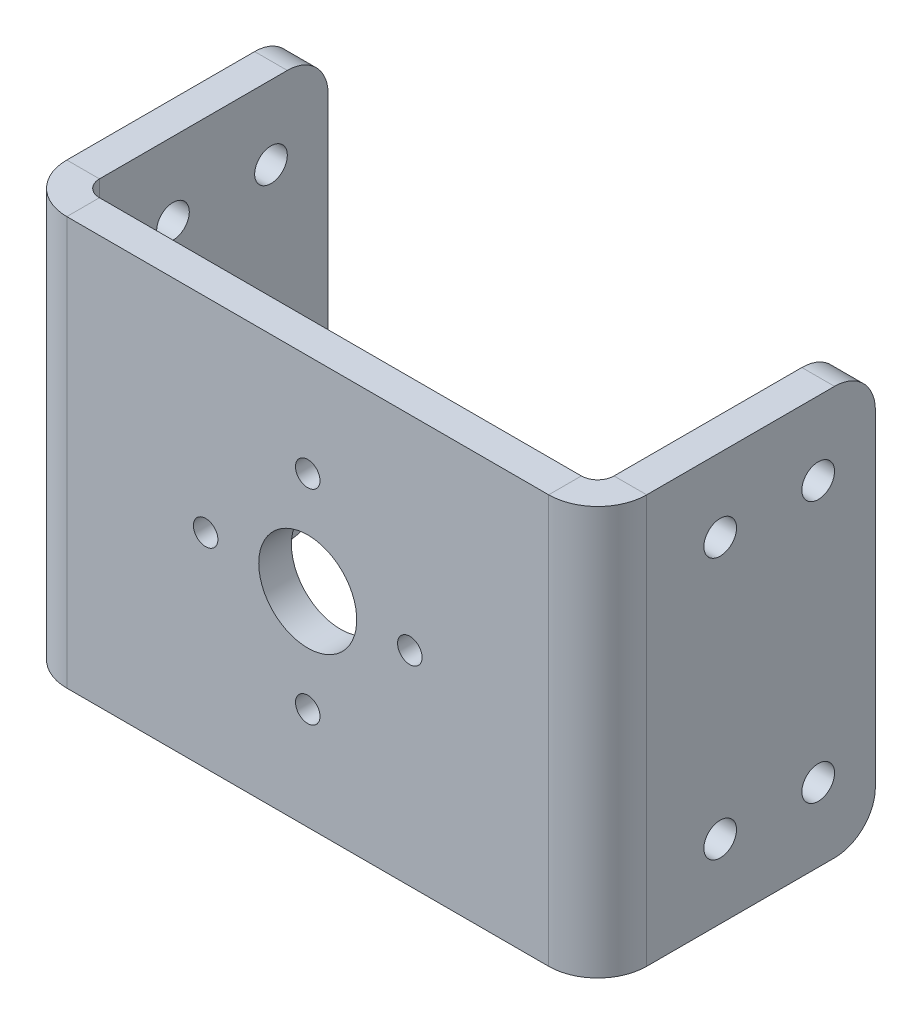
from build123d import *

# Parameters (mm, degrees)
SM_BASE_FLANGE_3_DEPTH = 50
SKETCH_14_R            = 6
SKETCH_14_R_2          = 1.5
CUT_EXTRUDE_1_DEPTH    = 69.26602376
SKETCH_15_R            = 2
CUT_EXTRUDE_2_DEPTH    = 94.257707456
FILLET_1_R             = 5


# Sheet-metal steps are written as plain solids
with BuildPart() as part:
    # 草图1 → 基体-法兰3 (new body)
    with BuildSketch(Plane(origin=(0, 0, 0), x_dir=(1, 0, 0), z_dir=(0, 1, 0))):
        with BuildLine():
            Line((-35.5, 34), (-35.5, 6))
            ThreePointArc((-35.5, 6), (-33.742640687, 1.757359313), (-29.5, 0))
            Line((-29.5, 0), (29.5, 0))
            ThreePointArc((29.5, 0), (33.742640687, 1.757359313), (35.5, 6))
            Line((35.5, 6), (35.5, 34))
            Line((35.5, 34), (31.5, 34))
            Line((31.5, 34), (31.5, 6))
            ThreePointArc((31.5, 6), (30.914213562, 4.585786438), (29.5, 4))
            Line((29.5, 4), (-29.5, 4))
            ThreePointArc((-29.5, 4), (-30.914213562, 4.585786438), (-31.5, 6))
            Line((-31.5, 6), (-31.5, 34))
            Line((-31.5, 34), (-35.5, 34))
        make_face()
    extrude(amount=SM_BASE_FLANGE_3_DEPTH)

    # 草图14 → 切除-拉伸1 (cut, through all)
    with BuildSketch(Plane(origin=(0, 0, -4), x_dir=(-1, 0, 0), z_dir=(0, 0, -1))):
        with Locations((0, 25)):
            Circle(SKETCH_14_R)
        with Locations((0, 37.5)):
            Circle(SKETCH_14_R_2)
        with Locations((12.5, 25)):
            Circle(SKETCH_14_R_2)
        with Locations((0, 12.5)):
            Circle(SKETCH_14_R_2)
        with Locations((-12.5, 25)):
            Circle(SKETCH_14_R_2)
    extrude(amount=-CUT_EXTRUDE_1_DEPTH, mode=Mode.SUBTRACT)

    # 草图15 → 切除-拉伸2 (cut, through all)
    with BuildSketch(Plane(origin=(35.5, 0, 0), x_dir=(0, 0, -1), z_dir=(1, 0, 0))):
        with Locations((15, 9)):
            Circle(SKETCH_15_R)
        with Locations((15, 41)):
            Circle(SKETCH_15_R)
        with Locations((27, 41)):
            Circle(SKETCH_15_R)
        with Locations((27, 9)):
            Circle(SKETCH_15_R)
    extrude(amount=-CUT_EXTRUDE_2_DEPTH, mode=Mode.SUBTRACT)

    # 圆角1
    fillet_1_edges = [part.edges().sort_by_distance(p)[0] for p in [
        (-33.5, 0, -34),
        (33.5, 0, -34),
        (-33.5, 50, -34),
        (33.5, 50, -34),
    ]]
    fillet(fillet_1_edges, radius=FILLET_1_R)


solid = part.part
